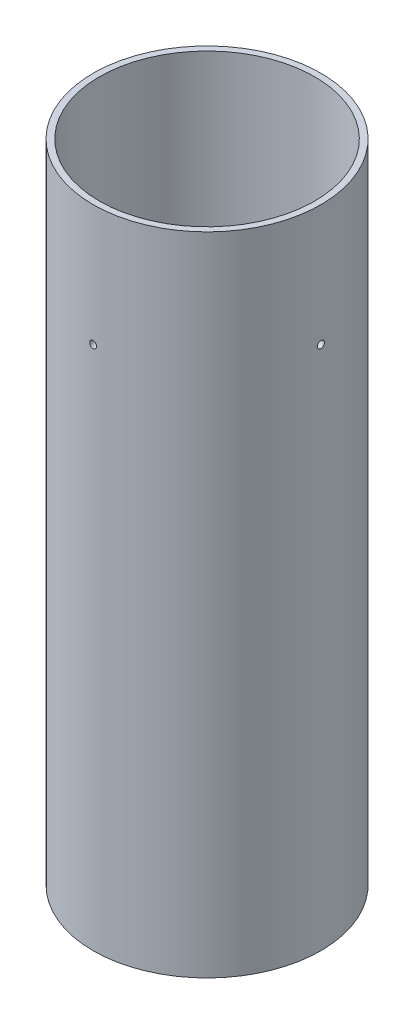
from build123d import *

# Parameters (mm, degrees)
SKETCH1_R            = 53.721
SKETCH1_R_2          = 50.8
TUBE_EXTRUSION_DEPTH = 304.8
CUT_EXTRUDE1_REACH   = 329.617
SKETCH2_R            = 1.6383
CIRPATTERN1_COUNT    = 4


with BuildPart() as part:
    # Sketch1 → Tube Extrusion (new body)
    with BuildSketch(Plane(origin=(0, 0, 0), x_dir=(1, 0, 0), z_dir=(0, 1, 0))):
        Circle(SKETCH1_R)
        Circle(SKETCH1_R_2, mode=Mode.SUBTRACT)
    extrude(amount=TUBE_EXTRUSION_DEPTH)

    # Sketch2 → Cut-Extrude1 (cut, up to next)
    with BuildSketch(Plane(origin=(53.721, 0, 0), x_dir=(0, 0, -1), z_dir=(1, 0, 0)), mode=Mode.PRIVATE) as cut_extrude1_sk1:
        with Locations((0, 247.65)):
            Circle(SKETCH2_R)
    cut_extrude1_tool1 = extrude(cut_extrude1_sk1.sketch, amount=-CUT_EXTRUDE1_REACH, mode=Mode.PRIVATE) & part.part
    cut_extrude1 = cut_extrude1_tool1.solids().sort_by_distance((53.721, 247.65, 0))[0]
    add(cut_extrude1, mode=Mode.SUBTRACT)

    # CirPattern1: Cut-Extrude1 ×4 about axis
    cirpattern1_axis = Axis((0, 304.8, 0), (0, -1, 0))
    for i in range(1, CIRPATTERN1_COUNT):
        add(cut_extrude1.rotate(cirpattern1_axis, i * 360 / CIRPATTERN1_COUNT), mode=Mode.SUBTRACT)


solid = part.part
